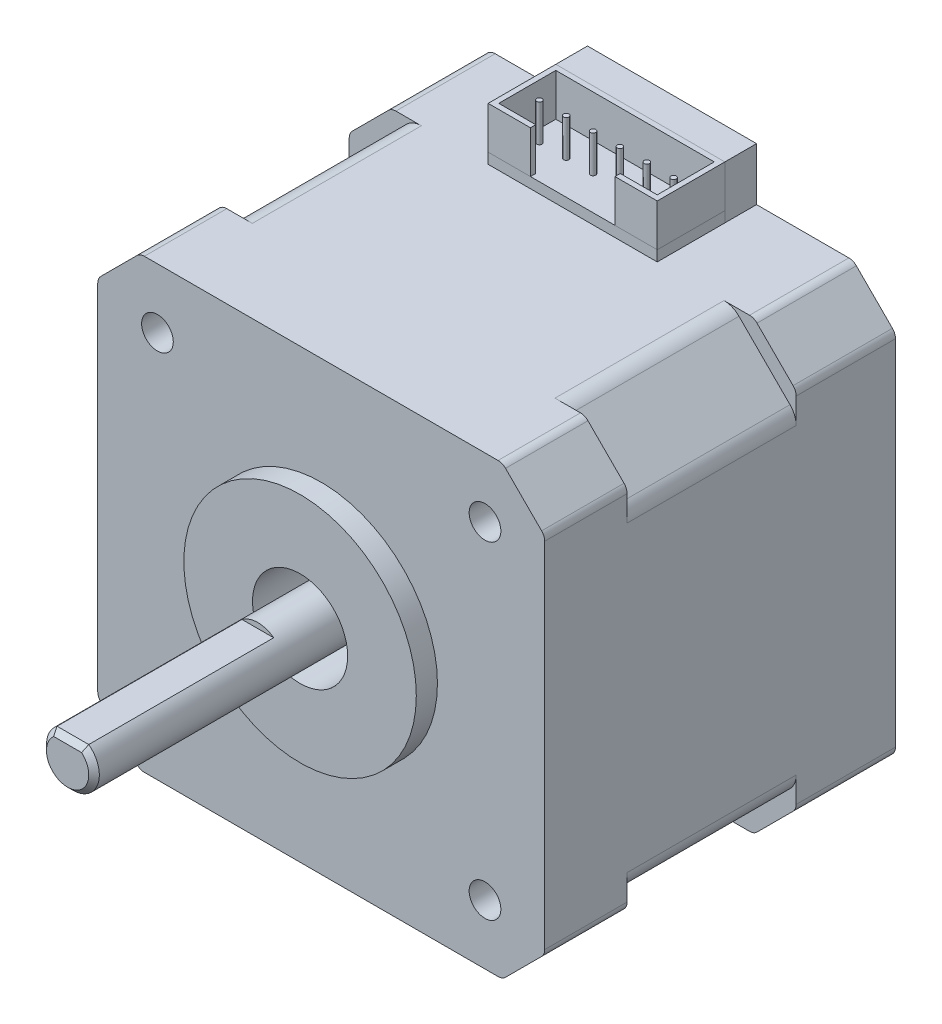
from build123d import *

# Parameters (mm, degrees)
EXTRUDE_1_DEPTH     = 33.2
CUT_EXTRUDE_1_DEPTH = 16
SKETCH_4_W          = 16
SKETCH_4_H          = 5
EXTRUDE_2_DEPTH     = 3
SKETCH_5_R          = 1.5
SKETCH_5_R_2        = 4.5
CUT_EXTRUDE_2_DEPTH = 4.5
SKETCH_6_R          = 2.2
EXTRUDE_3_DEPTH     = 2
SKETCH_7_R          = 3
CUT_EXTRUDE_3_DEPTH = 2
CUT_EXTRUDE_START   = -4.5
SKETCH_8_R          = 1.5
SKETCH_8_R_2        = 4.5
CUT_EXTRUDE_4_DEPTH = 4.5
SKETCH_9_R          = 2.5
EXTRUDE_4_DEPTH     = 28.5
CUT_EXTRUDE_START_2 = -18
CUT_EXTRUDE_5_DEPTH = 18
CHAMFER_1_SIZE      = 0.5
SKETCH_11_R         = 11
SKETCH_11_R_2       = 4.5
EXTRUDE_5_DEPTH     = 2
SKETCH_12_R         = 3.5
EXTRUDE_6_DEPTH     = 1
EXTRUDE_START       = 1
SKETCH_13_R         = 3.5
EXTRUDE_7_DEPTH     = 1
SKETCH_14_W         = 16
SKETCH_14_H         = 6.4
EXTRUDE_8_DEPTH     = 1
SKETCH_15_R         = 0.25
EXTRUDE_9_DEPTH     = 3.5
EXTRUDE_9_2_DEPTH   = 3.5
EXTRUDE_9_3_DEPTH   = 3.5
EXTRUDE_9_4_DEPTH   = 3.5
EXTRUDE_9_5_DEPTH   = 3.5
EXTRUDE_9_6_DEPTH   = 3.5
EXTRUDE_10_DEPTH    = 4


with BuildPart() as part:
    # 草图1 → 凸台-拉伸1 (new body)
    with BuildSketch(Plane.XY):
        with BuildLine():
            Line((0.292893219, 38.592893219), (3.707106781, 42.007106781))
            ThreePointArc((3.707106781, 42.007106781), (4.03153013, 42.223879533), (4.414213562, 42.3))
            Line((4.414213562, 42.3), (37.885786438, 42.3))
            ThreePointArc((37.885786438, 42.3), (38.26846987, 42.223879533), (38.592893219, 42.007106781))
            Line((38.592893219, 42.007106781), (42.007106781, 38.592893219))
            ThreePointArc((42.007106781, 38.592893219), (42.223879533, 38.26846987), (42.3, 37.885786438))
            Line((42.3, 37.885786438), (42.3, 4.414213562))
            ThreePointArc((42.3, 4.414213562), (42.223879533, 4.03153013), (42.007106781, 3.707106781))
            Line((42.007106781, 3.707106781), (38.592893219, 0.292893219))
            ThreePointArc((38.592893219, 0.292893219), (38.26846987, 0.076120467), (37.885786438, 0))
            Line((37.885786438, 0), (4.414213562, 0))
            ThreePointArc((4.414213562, 0), (4.03153013, 0.076120467), (3.707106781, 0.292893219))
            Line((3.707106781, 0.292893219), (0.292893219, 3.707106781))
            ThreePointArc((0.292893219, 3.707106781), (0.076120467, 4.03153013), (0, 4.414213562))
            Line((0, 4.414213562), (0, 37.885786438))
            ThreePointArc((0, 37.885786438), (0.076120467, 38.26846987), (0.292893219, 38.592893219))
        make_face()
    extrude(amount=EXTRUDE_1_DEPTH)

    # 草图3 → 切除-拉伸1 (cut)
    with BuildSketch(Plane.XY.offset(25.4)):
        with BuildLine():
            Line((5.414213562, 41.714213562), (0.585786438, 36.885786438))
            ThreePointArc((0.585786438, 36.885786438), (0.152240935, 36.23693974), (0, 35.471572875))
            Line((0, 35.471572875), (0, 42.3))
            Line((0, 42.3), (6.828427125, 42.3))
            ThreePointArc((6.828427125, 42.3), (6.06306026, 42.147759065), (5.414213562, 41.714213562))
        make_face()
        with BuildLine():
            Line((0.585786438, 5.414213562), (5.414213562, 0.585786438))
            ThreePointArc((5.414213562, 0.585786438), (6.06306026, 0.152240935), (6.828427125, 0))
            Line((6.828427125, 0), (0, 0))
            Line((0, 0), (0, 6.828427125))
            ThreePointArc((0, 6.828427125), (0.152240935, 6.06306026), (0.585786438, 5.414213562))
        make_face()
        with BuildLine():
            Line((36.885786438, 0.585786438), (41.714213562, 5.414213562))
            ThreePointArc((41.714213562, 5.414213562), (42.147759065, 6.06306026), (42.3, 6.828427125))
            Line((42.3, 6.828427125), (42.3, 0))
            Line((42.3, 0), (35.471572875, 0))
            ThreePointArc((35.471572875, 0), (36.23693974, 0.152240935), (36.885786438, 0.585786438))
        make_face()
        with BuildLine():
            Line((41.714213562, 36.885786438), (36.885786438, 41.714213562))
            ThreePointArc((36.885786438, 41.714213562), (36.23693974, 42.147759065), (35.471572875, 42.3))
            Line((35.471572875, 42.3), (42.3, 42.3))
            Line((42.3, 42.3), (42.3, 35.471572875))
            ThreePointArc((42.3, 35.471572875), (42.147759065, 36.23693974), (41.714213562, 36.885786438))
        make_face()
    extrude(amount=-CUT_EXTRUDE_1_DEPTH, mode=Mode.SUBTRACT)

    # 草图4 → 凸台-拉伸2 (add)
    with BuildSketch(Plane(origin=(0, 0, 0), x_dir=(-1, 0, 0), z_dir=(0, 0, -1))):
        with Locations((-21.15, 44.8)):
            Rectangle(SKETCH_4_W, SKETCH_4_H)
    extrude(amount=-EXTRUDE_2_DEPTH)

    # 草图5 → 切除-拉伸2 (cut)
    with BuildSketch(Plane(origin=(0, 0, 0), x_dir=(-1, 0, 0), z_dir=(0, 0, -1))):
        with Locations((-36.65, 36.65)):
            Circle(SKETCH_5_R)
        with Locations((-5.65, 36.65)):
            Circle(SKETCH_5_R)
        with Locations((-5.65, 5.65)):
            Circle(SKETCH_5_R)
        with Locations((-36.65, 5.65)):
            Circle(SKETCH_5_R)
        with Locations((-21.15, 21.15)):
            Circle(SKETCH_5_R_2)
    extrude(amount=-CUT_EXTRUDE_2_DEPTH, mode=Mode.SUBTRACT)

    # 草图6 → 凸台-拉伸3 (add)
    with BuildSketch(Plane(origin=(0, 0, 4.5), x_dir=(-1, 0, 0), z_dir=(0, 0, -1))):
        with Locations((-21.15, 21.15)):
            Circle(SKETCH_6_R)
    extrude(amount=EXTRUDE_3_DEPTH)

    # 草图7 → 切除-拉伸3 (cut)
    with BuildSketch(Plane(origin=(0, 0, 0), x_dir=(-1, 0, 0), z_dir=(0, 0, -1))):
        with Locations((-36.65, 36.65)):
            Circle(SKETCH_7_R)
        with Locations((-5.597185915, 36.500646673)):
            Circle(SKETCH_7_R)
        with Locations((-5.746539242, 5.447832589)):
            Circle(SKETCH_7_R)
        with Locations((-36.799353327, 5.597185915)):
            Circle(SKETCH_7_R)
    extrude(amount=-CUT_EXTRUDE_3_DEPTH, mode=Mode.SUBTRACT)

    # 草图8 → 切除-拉伸4 (cut)
    with BuildSketch(Plane.XY.offset(33.2).offset(CUT_EXTRUDE_START)):
        with Locations(Location((5.65, 5.65, 0), (0, 0, 180))):
            Circle(SKETCH_8_R)
        with Locations(Location((36.65, 5.65, 0), (0, 0, 180))):
            Circle(SKETCH_8_R)
        with Locations(Location((36.65, 36.65, 0), (0, 0, 180))):
            Circle(SKETCH_8_R)
        with Locations(Location((5.65, 36.65, 0), (0, 0, 180))):
            Circle(SKETCH_8_R)
        with Locations(Location((21.15, 21.15, 0), (0, 0, 180))):
            Circle(SKETCH_8_R_2)
    extrude(amount=CUT_EXTRUDE_4_DEPTH, mode=Mode.SUBTRACT)

    # 草图9 → 凸台-拉伸4 (add)
    with BuildSketch(Plane.XY.offset(28.7)):
        with Locations(Location((21.15, 21.15, 0), (0, 0, 180))):
            Circle(SKETCH_9_R)
    extrude(amount=EXTRUDE_4_DEPTH)

    # 草图10 → 切除-拉伸5 (cut)
    with BuildSketch(Plane.XY.offset(57.2).offset(CUT_EXTRUDE_START_2)):
        with BuildLine():
            Line((19.65, 23.15), (22.65, 23.15))
            ThreePointArc((22.65, 23.15), (21.15, 23.65), (19.65, 23.15))
        make_face()
    extrude(amount=CUT_EXTRUDE_5_DEPTH, mode=Mode.SUBTRACT)

    # 倒角1
    chamfer_1_edges = [part.edges().sort_by_distance(p)[0] for p in [
        (22.268033989, 18.913932023, 57.2),
        (21.15, 23.15, 57.2),
    ]]
    chamfer(chamfer_1_edges, length=CHAMFER_1_SIZE - 0.0001)  # a hair under: the kernel refuses the full size

    # 草图11 → 凸台-拉伸5 (add)
    with BuildSketch(Plane.XY.offset(33.2)):
        with Locations((21.15, 21.15)):
            Circle(SKETCH_11_R)
        with Locations(Location((21.15, 21.15, 0), (0, 0, 180))):
            Circle(SKETCH_11_R_2, mode=Mode.SUBTRACT)
    extrude(amount=EXTRUDE_5_DEPTH)

    # 草图12 → 凸台-拉伸6 (add)
    with BuildSketch(Plane(origin=(0, 0, 4.5), x_dir=(-1, 0, 0), z_dir=(0, 0, -1))):
        with Locations((-21.15, 21.15)):
            Circle(SKETCH_12_R)
    extrude(amount=EXTRUDE_6_DEPTH)

    # 草图13 → 凸台-拉伸7 (add)
    with BuildSketch(Plane.XY.offset(28.7).offset(EXTRUDE_START)):
        with Locations(Location((21.15, 21.15, 0), (0, 0, 180))):
            Circle(SKETCH_13_R)
    extrude(amount=-EXTRUDE_7_DEPTH)


with BuildPart() as body_2:
    # 草图14 → 凸台-拉伸8 (new body)
    with BuildSketch(Plane(origin=(0, 42.3, 0), x_dir=(1, 0, 0), z_dir=(0, 1, 0))):
        with Locations((21.15, -6.2)):
            Rectangle(SKETCH_14_W, SKETCH_14_H)
    extrude(amount=EXTRUDE_8_DEPTH)


with BuildPart() as body_3:
    # 草图15 → 凸台-拉伸9 (new body)
    with BuildSketch(Plane(origin=(0, 43.3, 0), x_dir=(1, 0, 0), z_dir=(0, 1, 0))):
        with Locations(Location((14.8, -6.2, 0), (0, 0, 270))):
            Circle(SKETCH_15_R)
    extrude(amount=EXTRUDE_9_DEPTH)


with BuildPart() as body_4:
    # 草图15 → Extrude 9 2 (new body)
    with BuildSketch(Plane(origin=(0, 43.3, 0), x_dir=(1, 0, 0), z_dir=(0, 1, 0))):
        with Locations(Location((17.34, -6.2, 0), (0, 0, 270))):
            Circle(SKETCH_15_R)
    extrude(amount=EXTRUDE_9_2_DEPTH)


with BuildPart() as body_5:
    # 草图15 → Extrude 9 3 (new body)
    with BuildSketch(Plane(origin=(0, 43.3, 0), x_dir=(1, 0, 0), z_dir=(0, 1, 0))):
        with Locations(Location((19.88, -6.2, 0), (0, 0, 270))):
            Circle(SKETCH_15_R)
    extrude(amount=EXTRUDE_9_3_DEPTH)


with BuildPart() as body_6:
    # 草图15 → Extrude 9 4 (new body)
    with BuildSketch(Plane(origin=(0, 43.3, 0), x_dir=(1, 0, 0), z_dir=(0, 1, 0))):
        with Locations(Location((22.42, -6.2, 0), (0, 0, 270))):
            Circle(SKETCH_15_R)
    extrude(amount=EXTRUDE_9_4_DEPTH)


with BuildPart() as body_7:
    # 草图15 → Extrude 9 5 (new body)
    with BuildSketch(Plane(origin=(0, 43.3, 0), x_dir=(1, 0, 0), z_dir=(0, 1, 0))):
        with Locations(Location((24.96, -6.2, 0), (0, 0, 270))):
            Circle(SKETCH_15_R)
    extrude(amount=EXTRUDE_9_5_DEPTH)


with BuildPart() as body_8:
    # 草图15 → Extrude 9 6 (new body)
    with BuildSketch(Plane(origin=(0, 43.3, 0), x_dir=(1, 0, 0), z_dir=(0, 1, 0))):
        with Locations(Location((27.5, -6.2, 0), (0, 0, 270))):
            Circle(SKETCH_15_R)
    extrude(amount=EXTRUDE_9_6_DEPTH)


with BuildPart() as body_9:
    # 草图16 → 凸台-拉伸10 (new body)
    with BuildSketch(Plane(origin=(0, 43.3, 0), x_dir=(1, 0, 0), z_dir=(0, 1, 0))):
        Polygon((17.15, -8.9), (17.15, -9.4), (13.15, -9.4), (13.15, -3), (29.15, -3), (29.15, -9.4), (25.15, -9.4), (25.15, -8.9), (28.65, -8.9), (28.65, -3.5), (13.65, -3.5), (13.65, -8.9), align=None)
    extrude(amount=EXTRUDE_10_DEPTH)


solid = Compound([part.part, body_2.part, body_3.part, body_4.part, body_5.part, body_6.part, body_7.part, body_8.part, body_9.part])
